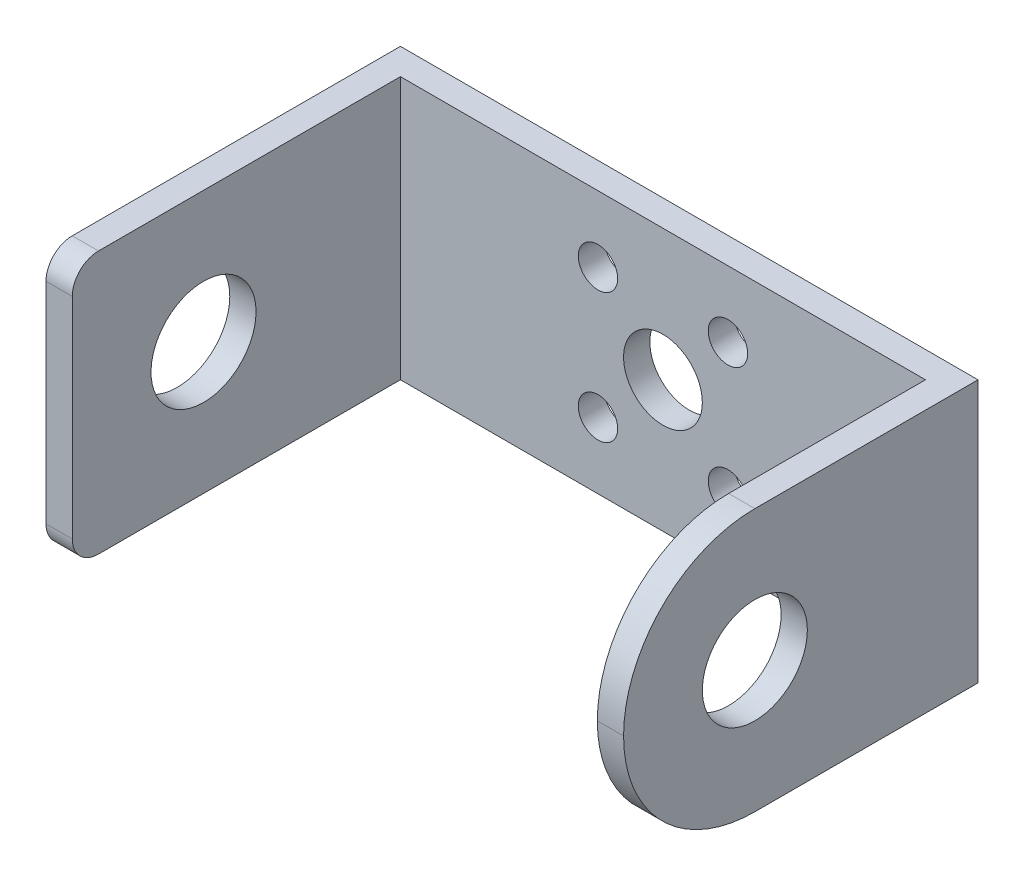
from build123d import *

# Parameters (mm, degrees)
CROQUIS1_W              = 44
CROQUIS1_H              = 20
SALIENTE_EXTRUIR1_DEPTH = 2
CROQUIS2_R              = 3
CROQUIS2_R_2            = 1.5
CORTAR_EXTRUIR1_DEPTH   = 2
CROQUIS3_W              = 2
CROQUIS3_H              = 20
SALIENTE_EXTRUIR2_DEPTH = 25
REDONDEO1_R             = 10
REDONDEO2_R             = 2
CORTAR_EXTRUIR2_REACH   = 54.583
CROQUIS4_R              = 4


with BuildPart() as part:
    # Croquis1 → Saliente-Extruir1 (new body)
    with BuildSketch(Plane.XY):
        Rectangle(CROQUIS1_W, CROQUIS1_H)
    extrude(amount=SALIENTE_EXTRUIR1_DEPTH)

    # Croquis2 → Cortar-Extruir1 (cut)
    with BuildSketch(Plane.XY.offset(2)):
        Circle(CROQUIS2_R)
        with Locations((-4.949747468, 4.949747468)):
            Circle(CROQUIS2_R_2)
        with Locations(Location((4.949747468, 4.949747468, 0), (0, 0, 180))):
            Circle(CROQUIS2_R_2)
        with Locations((4.949747468, -4.949747468)):
            Circle(CROQUIS2_R_2)
        with Locations(Location((-4.949747468, -4.949747468, 0), (0, 0, 180))):
            Circle(CROQUIS2_R_2)
    extrude(amount=-CORTAR_EXTRUIR1_DEPTH, mode=Mode.SUBTRACT)

    # Croquis3 → Saliente-Extruir2 (add)
    with BuildSketch(Plane.XY.offset(2)):
        with Locations((-21, 0)):
            Rectangle(CROQUIS3_W, CROQUIS3_H)
        with Locations((21, 0)):
            Rectangle(CROQUIS3_W, CROQUIS3_H)
    extrude(amount=SALIENTE_EXTRUIR2_DEPTH)

    # Redondeo1
    redondeo1_edges = [part.edges().sort_by_distance(p)[0] for p in [
        (21, 10, 27),
        (21, -10, 27),
    ]]
    fillet(redondeo1_edges, radius=REDONDEO1_R - 0.0001)  # a hair under: the kernel refuses the full size

    # Redondeo2
    redondeo2_edges = [part.edges().sort_by_distance(p)[0] for p in [
        (-21, -10, 27),
        (-21, 10, 27),
    ]]
    fillet(redondeo2_edges, radius=REDONDEO2_R)

    # Cortar-Extruir2: up to this face of the body (flat: up to its plane)
    cortar_extruir2_end = Plane(part.part.faces().sort_by_distance((-22, 0, 13.458367573))[0])
    # Croquis4 → Cortar-Extruir2 (cut, up to the picked face)
    with BuildSketch(Plane(origin=(22, 0, 0), x_dir=(0, 0, -1), z_dir=(1, 0, 0)), mode=Mode.PRIVATE) as cortar_extruir2_sk1:
        with Locations((-17, 0)):
            Circle(CROQUIS4_R)
    cortar_extruir2_tool1 = split(extrude(cortar_extruir2_sk1.sketch, amount=-CORTAR_EXTRUIR2_REACH, mode=Mode.PRIVATE), bisect_by=cortar_extruir2_end, keep=Keep.BOTH, mode=Mode.PRIVATE)
    add(cortar_extruir2_tool1.solids().sort_by(Axis((22, 0, 17), (-1, 0, 0)))[0], mode=Mode.SUBTRACT)


solid = part.part
